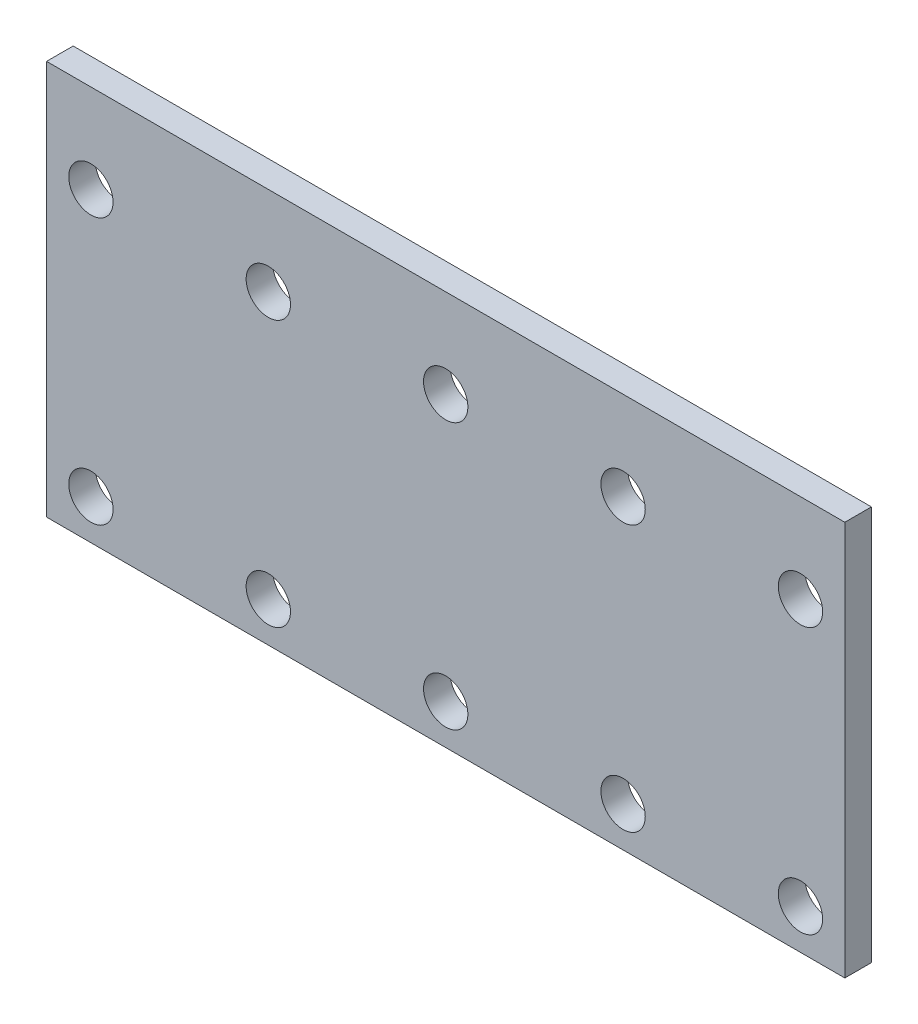
from build123d import *

# Parameters (mm, degrees)
SKETCH1_W           = 90
SKETCH1_H           = 44.5
SKETCH1_R           = 2.5
BOSS_EXTRUDE1_DEPTH = 3


with BuildPart() as part:
    # Sketch1 → Boss-Extrude1 (new body)
    with BuildSketch(Plane.XY):
        with Locations((45, 22.25)):
            Rectangle(SKETCH1_W, SKETCH1_H)
        with Locations((5, 4.5)):
            Circle(SKETCH1_R, mode=Mode.SUBTRACT)
        with Locations((25, 4.5)):
            Circle(SKETCH1_R, mode=Mode.SUBTRACT)
        with Locations((45, 4.5)):
            Circle(SKETCH1_R, mode=Mode.SUBTRACT)
        with Locations((65, 4.5)):
            Circle(SKETCH1_R, mode=Mode.SUBTRACT)
        with Locations((85, 4.5)):
            Circle(SKETCH1_R, mode=Mode.SUBTRACT)
        with Locations((85, 34.5)):
            Circle(SKETCH1_R, mode=Mode.SUBTRACT)
        with Locations((5, 34.5)):
            Circle(SKETCH1_R, mode=Mode.SUBTRACT)
        with Locations((25, 34.5)):
            Circle(SKETCH1_R, mode=Mode.SUBTRACT)
        with Locations((45, 34.5)):
            Circle(SKETCH1_R, mode=Mode.SUBTRACT)
        with Locations((65, 34.5)):
            Circle(SKETCH1_R, mode=Mode.SUBTRACT)
    extrude(amount=BOSS_EXTRUDE1_DEPTH)


solid = part.part
